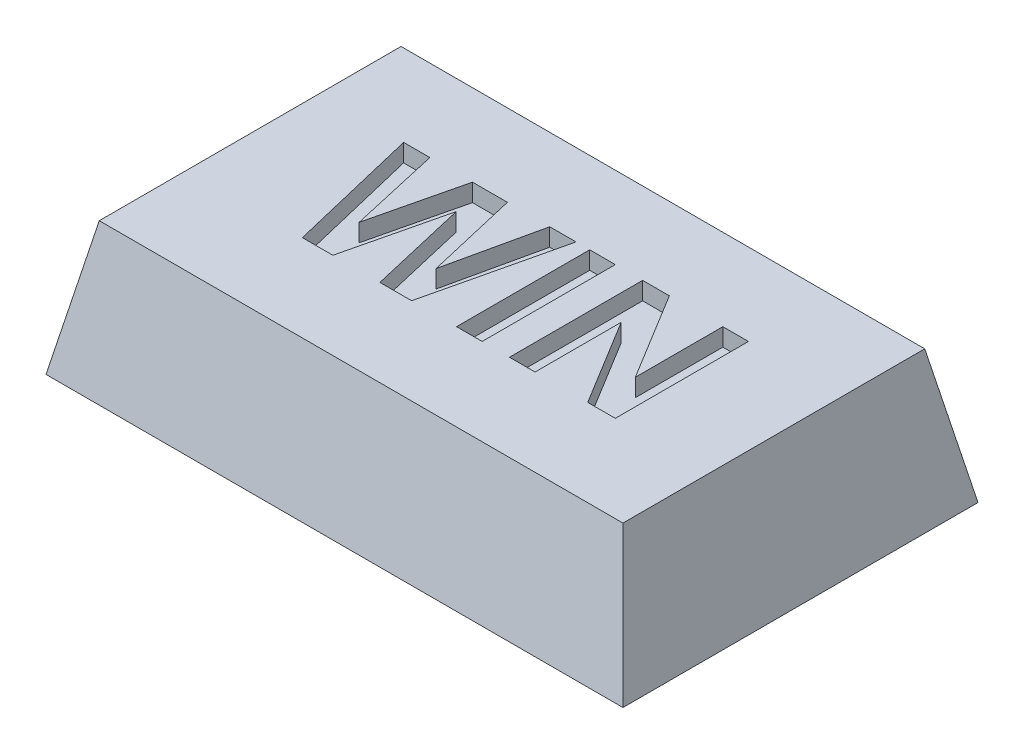
from build123d import *

# Parameters (mm, degrees)
SKETCH1_W               = 13
SKETCH1_H               = 8
BOSS_EXTRUDE1_DEPTH     = 3
CUT_EXTRUDE1_DEPTH      = 16.556349186
CUT_EXTRUDE1_DEPTH_BACK = 16.556349186
CUT_EXTRUDE2_DEPTH      = 16.556349186
CUT_EXTRUDE2_DEPTH_BACK = 16.556349186
SKETCH4_R               = 1.75
CUT_EXTRUDE3_DEPTH      = 0.4
SKETCH5_W               = 8
SKETCH5_H               = 1.1
BOSS_EXTRUDE2_DEPTH     = 2
FILLET1_R               = 4
SKETCH6_W               = 0.576923077
SKETCH6_H               = 3
CUT_EXTRUDE4_DEPTH      = 0.4


with BuildPart() as part:
    # Sketch1 → Boss-Extrude1 (new body)
    with BuildSketch(Plane(origin=(0, 0, 0), x_dir=(1, 0, 0), z_dir=(0, 1, 0))):
        with Locations((6.5, 4)):
            Rectangle(SKETCH1_W, SKETCH1_H)
    extrude(amount=BOSS_EXTRUDE1_DEPTH)

    # Sketch2 → Cut-Extrude1 (cut, two sides: drawn at the far end of the back side and taken through both)
    with BuildSketch(Plane.XY.offset(-CUT_EXTRUDE1_DEPTH_BACK)):
        Polygon((0, 0), (0.6, 3), (0, 3), align=None)
        Polygon((13, 0), (12.4, 3), (13, 3), align=None)
    extrude(amount=CUT_EXTRUDE1_DEPTH + CUT_EXTRUDE1_DEPTH_BACK, mode=Mode.SUBTRACT)

    # Sketch3 → Cut-Extrude2 (cut, two sides: drawn at the far end of the back side and taken through both)
    with BuildSketch(Plane(origin=(0, 0, 0), x_dir=(0, 0, -1), z_dir=(1, 0, 0)).offset(-CUT_EXTRUDE2_DEPTH_BACK)):
        Polygon((0, 0), (0.6, 3), (0, 3), align=None)
        Polygon((8, 3), (7.4, 3), (8, 0), align=None)
    extrude(amount=CUT_EXTRUDE2_DEPTH + CUT_EXTRUDE2_DEPTH_BACK, mode=Mode.SUBTRACT)

    # Sketch4 → Cut-Extrude3 (cut)
    with BuildSketch(Plane.XZ):
        with Locations(Location((6.50000125, -3.75, 0), (0, 0, 270))):
            Circle(SKETCH4_R)
    extrude(amount=-CUT_EXTRUDE3_DEPTH, mode=Mode.SUBTRACT)

    # Sketch5 → Boss-Extrude2 (add)
    with BuildSketch(Plane.XZ):
        with Locations((6.500011, -7.45)):
            Rectangle(SKETCH5_W, SKETCH5_H)
    extrude(amount=BOSS_EXTRUDE2_DEPTH)

    # Fillet1
    # the kernel refuses this fillet: 4 mm, written as the material it takes off along each edge
    with BuildSketch(Plane(origin=(10.500011, -2, -16.660254038), x_dir=(0, 1, 0), z_dir=(0, 0, 1)), Plane(origin=(2.500011, -2, 1.760254038), x_dir=(0, 1, 0), z_dir=(0, 0, -1))) as fillet1_piece_1:
        with BuildLine():
            CenterArc((4, 3.464101615), FILLET1_R, 180, 60)
            Line((0, 3.464101615), (-0.08, 3.464101615))
            Line((-0.08, 3.464101615), (-0.08, 0))
            Line((-0.08, 0), (0, -0.08))
            ThreePointArc((0, -0.08), (1, -0.08), (1.96, -0.069282032))
            Line((1.96, -0.069282032), (2, 0))
        make_face()
    extrude(amount=18.420508076, mode=Mode.SUBTRACT)

    # Sketch6 → Cut-Extrude4 (cut)
    with BuildSketch(Plane(origin=(0, 3, 0), x_dir=(1, 0, 0), z_dir=(0, 1, 0))):
        Polygon((3.219165588, 2.557267472), (2.50101655, 5.557267472), (3.092362704, 5.557267472), (3.558708858, 3.496570357), (4.052098281, 5.557267472), (4.839357896, 5.557267472), (5.327939627, 3.461714587), (5.793083858, 5.557267472), (6.385631934, 5.557267472), (5.68070405, 2.557267472), (4.966160781, 2.557267472), (4.443324242, 4.800055934), (3.906665588, 2.557267472), align=None)
        with Locations((6.981785781, 4.057267472)):
            Rectangle(SKETCH6_W, SKETCH6_H)
        Polygon((7.885631934, 2.557267472), (7.885631934, 5.557267472), (8.488396358, 5.557267472), (9.693324242, 3.584911703), (9.693324242, 5.557267472), (10.270247319, 5.557267472), (10.270247319, 2.557267472), (9.648853088, 2.557267472), (8.462555011, 4.498373241), (8.462555011, 2.557267472), align=None)
    extrude(amount=-CUT_EXTRUDE4_DEPTH, mode=Mode.SUBTRACT)


solid = part.part
